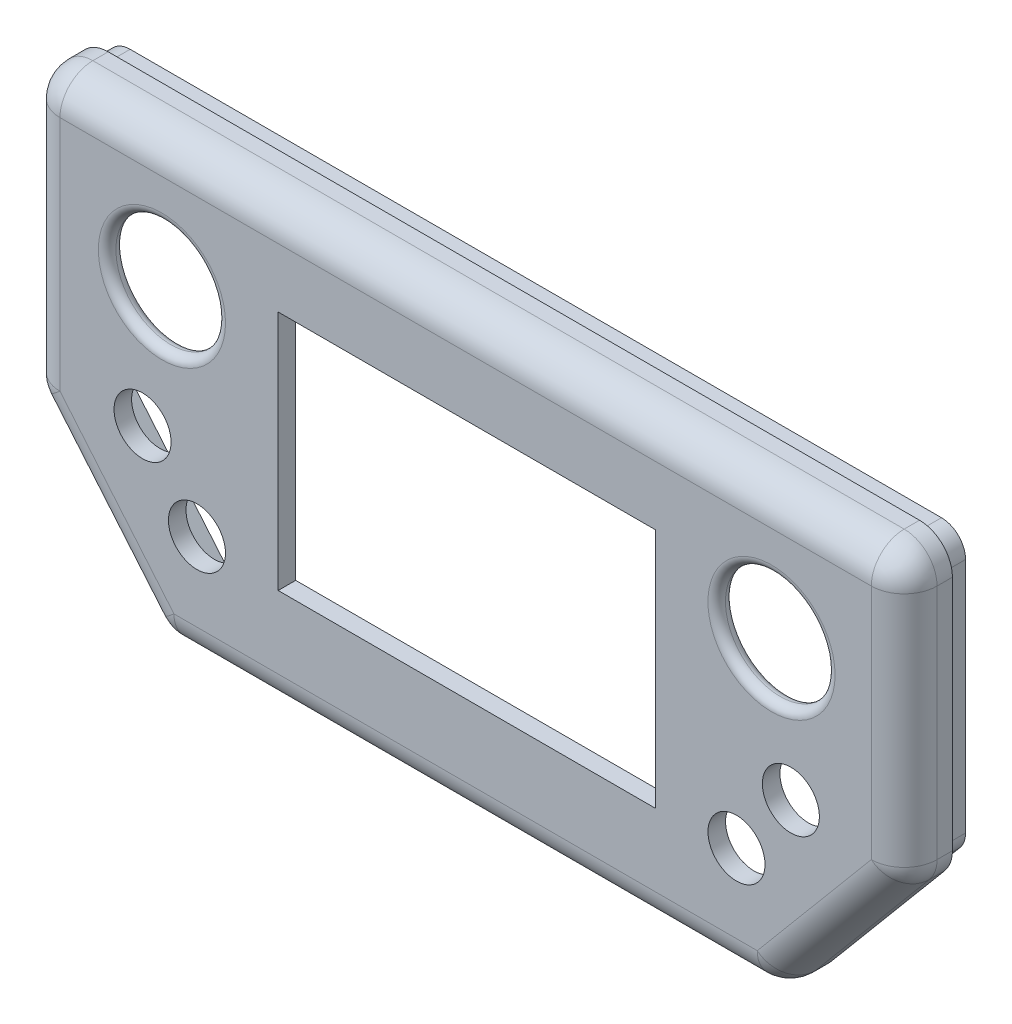
from build123d import *

# Parameters (mm, degrees)
BOSS_EXTRUDE1_DEPTH = 11
SHELL1_T            = -4
FILLET1_R           = 7.5
BOSS_EXTRUDE2_START = 5
BOSS_EXTRUDE2_DEPTH = 5
SKETCH3_W           = 86
SKETCH3_H           = 55
CUT_EXTRUDE1_DEPTH  = 10
SKETCH4_R           = 12.5
SKETCH4_R_2         = 6.5
CUT_EXTRUDE2_DEPTH  = 10
FILLET2_R           = 2


with BuildPart() as part:
    # Sketch1 → Boss-Extrude1 (new body)
    with BuildSketch(Plane.XY):
        with BuildLine():
            Line((-32.761189707, -78.36284634), (-6.76388227, -109.345230875))
            ThreePointArc((-6.76388227, -109.345230875), (-4.18818591, -111.321632205), (-1.018548947, -112.024323803))
            Line((-1.018548947, -112.024323803), (131.986836181, -112.024323803))
            ThreePointArc((131.986836181, -112.024323803), (135.156473144, -111.321632205), (137.732169504, -109.345230875))
            Line((137.732169504, -109.345230875), (163.72947694, -78.36284634))
            ThreePointArc((163.72947694, -78.36284634), (165.031838273, -76.107090343), (165.484143617, -73.541939268))
            Line((165.484143617, -73.541939268), (165.484143617, -19.524323803))
            ThreePointArc((165.484143617, -19.524323803), (163.287444476, -14.221022944), (157.984143617, -12.024323803))
            Line((157.984143617, -12.024323803), (-27.015856383, -12.024323803))
            ThreePointArc((-27.015856383, -12.024323803), (-32.319157242, -14.221022944), (-34.515856383, -19.524323803))
            Line((-34.515856383, -19.524323803), (-34.515856383, -73.541939268))
            ThreePointArc((-34.515856383, -73.541939268), (-34.063551039, -76.107090343), (-32.761189707, -78.36284634))
        make_face()
    extrude(amount=BOSS_EXTRUDE1_DEPTH)

    # Shell1
    shell1_openings = [part.faces().sort_by_distance(p)[0] for p in [
        (65.484143617, -59.914594693, 0),
    ]]
    offset(amount=SHELL1_T, openings=shell1_openings, kind=Kind.INTERSECTION)

    # Fillet1
    fillet1_edges = [part.edges().sort_by_distance(p)[0] for p in [
        (135.156473144, -111.321632205, 11),
        (150.730823222, -93.854038608, 11),
        (165.031838273, -76.107090343, 11),
        (165.484143617, -46.533131535, 11),
        (163.287444476, -14.221022944, 11),
        (65.484143617, -12.024323803, 11),
        (-32.319157242, -14.221022944, 11),
        (-34.515856383, -46.533131535, 11),
        (-34.063551039, -76.107090343, 11),
        (-19.762535988, -93.854038608, 11),
        (-4.18818591, -111.321632205, 11),
        (65.484143617, -112.024323803, 11),
    ]]
    fillet(fillet1_edges, radius=FILLET1_R)

    # Sketch2 → Boss-Extrude2 (add)
    with BuildSketch(Plane(origin=(0, 0, 0), x_dir=(-1, 0, 0), z_dir=(0, 0, -1)).offset(BOSS_EXTRUDE2_START)):
        with BuildLine():
            Line((5.231793384, -108.059655656), (31.22910082, -77.077271121))
            ThreePointArc((31.22910082, -77.077271121), (32.184165797, -75.423050056), (32.515856383, -73.541939268))
            Line((32.515856383, -73.541939268), (32.515856383, -19.524323803))
            ThreePointArc((32.515856383, -19.524323803), (30.90494368, -15.635236506), (27.015856383, -14.024323803))
            Line((27.015856383, -14.024323803), (-157.984143617, -14.024323803))
            ThreePointArc((-157.984143617, -14.024323803), (-161.873230913, -15.635236506), (-163.484143617, -19.524323803))
            Line((-163.484143617, -19.524323803), (-163.484143617, -73.541939268))
            ThreePointArc((-163.484143617, -73.541939268), (-163.152453031, -75.423050056), (-162.197388054, -77.077271121))
            Line((-162.197388054, -77.077271121), (-136.200080618, -108.059655656))
            ThreePointArc((-136.200080618, -108.059655656), (-134.31123662, -109.509016631), (-131.986836181, -110.024323803))
            Line((-131.986836181, -110.024323803), (1.018548947, -110.024323803))
            ThreePointArc((1.018548947, -110.024323803), (3.342949387, -109.509016631), (5.231793384, -108.059655656))
        make_face()
        with BuildLine():
            Line((3.699704498, -106.774080437), (29.697011934, -75.791695902))
            ThreePointArc((29.697011934, -75.791695902), (30.304780556, -74.739009769), (30.515856383, -73.541939268))
            Line((30.515856383, -73.541939268), (30.515856383, -19.524323803))
            ThreePointArc((30.515856383, -19.524323803), (29.490730117, -17.049450068), (27.015856383, -16.024323803))
            Line((27.015856383, -16.024323803), (-157.984143617, -16.024323803))
            ThreePointArc((-157.984143617, -16.024323803), (-160.459017351, -17.049450068), (-161.484143617, -19.524323803))
            Line((-161.484143617, -19.524323803), (-161.484143617, -73.541939268))
            ThreePointArc((-161.484143617, -73.541939268), (-161.27306779, -74.739009769), (-160.665299168, -75.791695902))
            Line((-160.665299168, -75.791695902), (-134.667991732, -106.774080437))
            ThreePointArc((-134.667991732, -106.774080437), (-133.466000097, -107.696401057), (-131.986836181, -108.024323803))
            Line((-131.986836181, -108.024323803), (1.018548947, -108.024323803))
            ThreePointArc((1.018548947, -108.024323803), (2.497712863, -107.696401057), (3.699704498, -106.774080437))
        make_face(mode=Mode.SUBTRACT)
    extrude(amount=-BOSS_EXTRUDE2_DEPTH)

    # Sketch3 → Cut-Extrude1 (cut)
    with BuildSketch(Plane.XY.offset(11)):
        with Locations((65.734143617, -60.524323803)):
            Rectangle(SKETCH3_W, SKETCH3_H)
    extrude(amount=-CUT_EXTRUDE1_DEPTH, mode=Mode.SUBTRACT)

    # Sketch4 → Cut-Extrude2 (cut)
    with BuildSketch(Plane.XY.offset(11)):
        with Locations((-3.765856383, -41.224323803)):
            Circle(SKETCH4_R)
        with Locations((-8.183616573, -70.961609401)):
            Circle(SKETCH4_R_2)
        with Locations((4.218548656, -86.65193437)):
            Circle(SKETCH4_R_2)
        with Locations((127.249738577, -86.65193437)):
            Circle(SKETCH4_R_2)
        with Locations((139.651903807, -70.961609401)):
            Circle(SKETCH4_R_2)
        with Locations((135.234143617, -41.224323803)):
            Circle(SKETCH4_R)
    extrude(amount=-CUT_EXTRUDE2_DEPTH, mode=Mode.SUBTRACT)

    # Fillet2
    fillet2_edges = [part.edges().sort_by_distance(p)[0] for p in [
        (122.734143617, -41.224323803, 7),
        (122.734143617, -41.224323803, 11),
        (-16.265856383, -41.224323803, 7),
        (-16.265856383, -41.224323803, 11),
    ]]
    fillet(fillet2_edges, radius=FILLET2_R - 0.0001)  # a hair under: the kernel refuses the full size


solid = part.part
